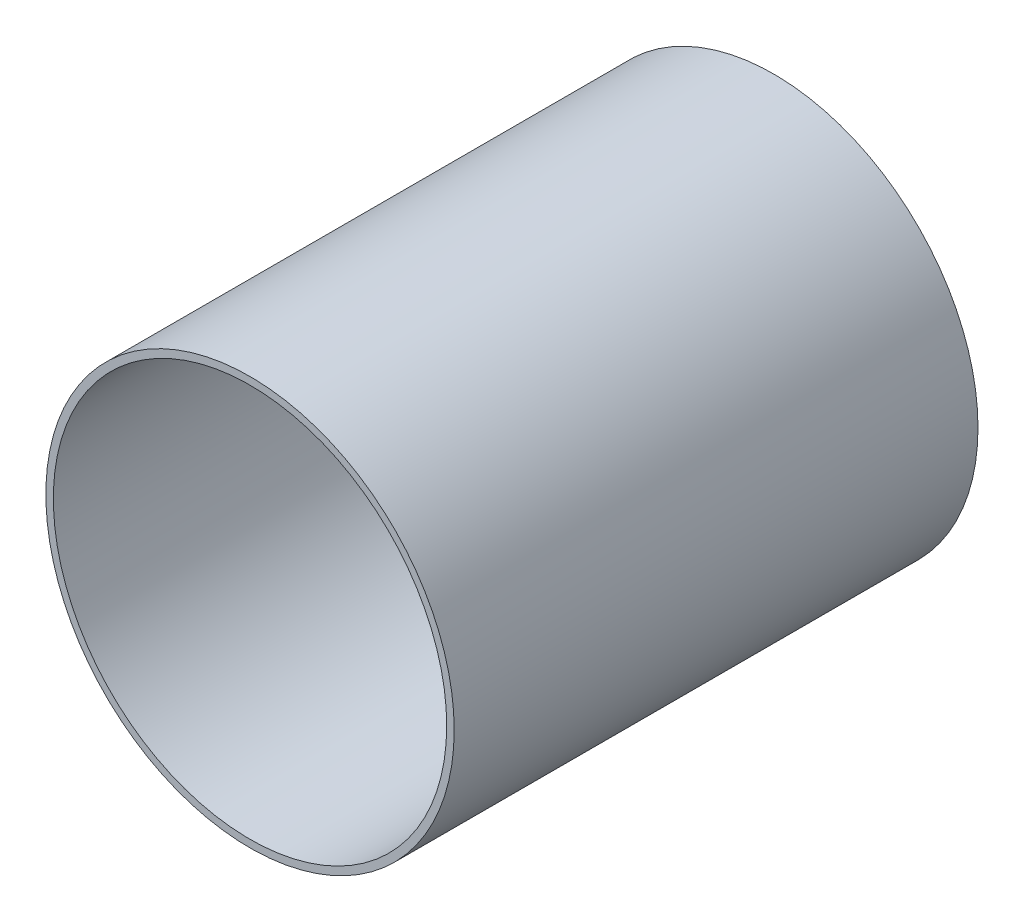
from build123d import *

# Parameters (mm, degrees)
SKETCH1_R           = 49.5046
SKETCH1_R_2         = 47.6885
BOSS_EXTRUDE1_DEPTH = 127


with BuildPart() as part:
    # Sketch1 → Boss-Extrude1 (new body)
    with BuildSketch(Plane.XY):
        Circle(SKETCH1_R)
        Circle(SKETCH1_R_2, mode=Mode.SUBTRACT)
    extrude(amount=BOSS_EXTRUDE1_DEPTH)


solid = part.part
